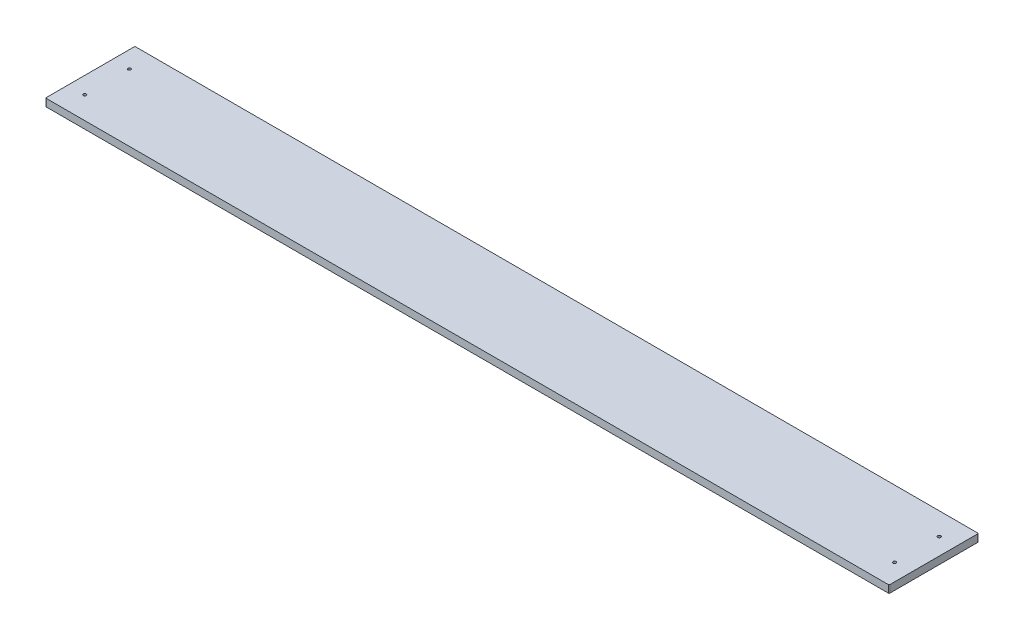
from build123d import *

# Parameters (mm, degrees)
SKETCH1_W              = 1439.06875
SKETCH1_H              = 152.4
BOSS_EXTRUDE1_DEPTH    = 12.7
F_10_CLEARANCE_HOLE1_D = 5.1054
FILLET1_R              = 1.27


with BuildPart() as part:
    # Sketch1 → Boss-Extrude1 (new body)
    with BuildSketch(Plane(origin=(0, 0, 0), x_dir=(1, 0, 0), z_dir=(0, 1, 0))):
        Rectangle(SKETCH1_W, SKETCH1_H)
    extrude(amount=BOSS_EXTRUDE1_DEPTH)

    # #10 Clearance Hole1 (through all)
    with Locations(Plane(origin=(0, 12.7, 0), x_dir=(1, 0, 0), z_dir=(0, 1, 0))):
        with Locations((690.768875, 38.1), (690.768875, -38.1), (-690.768875, 38.1), (-690.768875, -38.1)):
            Hole(F_10_CLEARANCE_HOLE1_D / 2)

    # Fillet1
    fillet1_edges = [part.edges().sort_by_distance(p)[0] for p in [
        (-719.534375, 6.35, 76.2),
        (-719.534375, 6.35, -76.2),
        (719.534375, 6.35, 76.2),
        (719.534375, 6.35, -76.2),
    ]]
    fillet(fillet1_edges, radius=FILLET1_R)


solid = part.part
